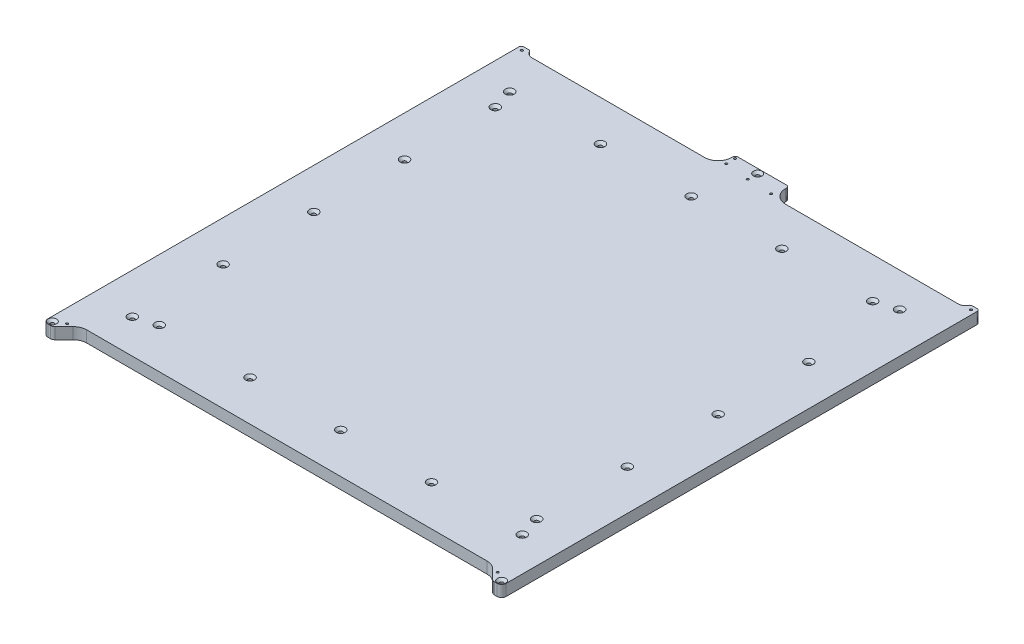
from build123d import *

# Parameters (mm, degrees)
BOSS_EXTRUDE1_DEPTH                             = 12.7
CSK_FOR_M4_FLAT_HEAD_MACHINE_SCREW1_D           = 4.3
CSK_FOR_M4_FLAT_HEAD_MACHINE_SCREW1_CSINK_D     = 9.4
CSK_FOR_M4_FLAT_HEAD_MACHINE_SCREW1_CSINK_ANGLE = 90
CHAMFER1_SIZE                                   = 16
SKETCH6_W                                       = 10
SKETCH6_H                                       = 6
BOSS_EXTRUDE2_DEPTH                             = 12.7
FILLET5_R                                       = 8
M3X0_5_TAPPED_HOLE1_D                           = 2.5
FILLET6_START                                   = -1
FILLET6_DEPTH                                   = 15
SKETCH18_W                                      = 25
SKETCH18_H                                      = 19
BOSS_EXTRUDE4_DEPTH                             = 12.7
FILLET11_R                                      = 15
FILLET12_R                                      = 3
M3X0_5_TAPPED_HOLE2_D                           = 2.5
CSK_FOR_M4_FLAT_HEAD_MACHINE_SCREW2_D           = 4.5
CSK_FOR_M4_FLAT_HEAD_MACHINE_SCREW2_CSINK_D     = 9.9
CSK_FOR_M4_FLAT_HEAD_MACHINE_SCREW2_CSINK_ANGLE = 90


with BuildPart() as part:
    # Sketch1 → Boss-Extrude1 (new body)
    with BuildSketch(Plane(origin=(0, 0, 0), x_dir=(1, 0, 0), z_dir=(0, 1, 0))):
        Polygon((-5, 274), (5, 274), (5, 255), (255, 255), (255, -271), (245, -271), (245, -255), (-245, -255), (-245, -271), (-255, -271), (-255, 255), (-5, 255), align=None)
    extrude(amount=BOSS_EXTRUDE1_DEPTH)

    # CSK for M4 Flat Head Machine Screw1 (through all)
    with Locations(Plane(origin=(0, 12.7, 0), x_dir=(1, 0, 0), z_dir=(0, 1, 0))):
        with Locations((0, 269), (-250, -266), (250, -266)):
            CounterSinkHole(CSK_FOR_M4_FLAT_HEAD_MACHINE_SCREW1_D / 2, CSK_FOR_M4_FLAT_HEAD_MACHINE_SCREW1_CSINK_D / 2, counter_sink_angle=CSK_FOR_M4_FLAT_HEAD_MACHINE_SCREW1_CSINK_ANGLE)

    # Chamfer1
    chamfer1_edges = [part.edges().sort_by_distance(p)[0] for p in [
        (245, 6.35, 255),
        (-245, 6.35, 255),
    ]]
    chamfer(chamfer1_edges, length=CHAMFER1_SIZE - 0.0001)  # a hair under: the kernel refuses the full size

    # Sketch6 → Boss-Extrude2 (add)
    with BuildSketch(Plane(origin=(0, 12.7, 0), x_dir=(1, 0, 0), z_dir=(0, 1, 0))):
        with Locations((-250, 258)):
            Rectangle(SKETCH6_W, SKETCH6_H)
        with Locations((250, 258)):
            Rectangle(SKETCH6_W, SKETCH6_H)
    extrude(amount=-BOSS_EXTRUDE2_DEPTH)

    # Fillet5
    # the kernel refuses this fillet: 8 mm, written as the material it adds along each edge
    with BuildSketch(Plane(origin=(245, 12.7, -255), x_dir=(0, 0, -1), z_dir=(0, -1, 0))) as fillet5_piece_1:
        with BuildLine():
            CenterArc((8, -7.745966692), FILLET5_R, 104.477512186, 75.522487814)
            Line((0, -7.745966692), (-0.16, -7.745966692))
            Line((-0.16, -7.745966692), (-0.16, 0))
            Line((-0.16, 0), (0, 0.16))
            ThreePointArc((0, 0.16), (3, 0.16), (5.96, 0.154919334))
            Line((5.96, 0.154919334), (6, 0))
        make_face()
    extrude(amount=12.7)
    with BuildSketch(Plane(origin=(-245, 12.7, -255), x_dir=(1, 0, 0), z_dir=(0, -1, 0))) as fillet5_piece_2:
        with BuildLine():
            CenterArc((7.745966692, -8), FILLET5_R, 90, 75.522487814)
            Line((0, -6), (-0.154919334, -5.96))
            ThreePointArc((-0.154919334, -5.96), (-0.16, -3), (-0.16, 0))
            Line((-0.16, 0), (0, 0.16))
            Line((0, 0.16), (7.745966692, 0.16))
            Line((7.745966692, 0.16), (7.745966692, 0))
        make_face()
    extrude(amount=12.7)

    # M3x0.5 Tapped Hole1 (through all)
    with Locations(Plane(origin=(0, 12.7, 0), x_dir=(1, 0, 0), z_dir=(0, 1, 0))):
        with Locations((-250, 256.5), (250, 256.5), (239.607695155, -260), (-239.607695155, -260), (0, 258)):
            Hole(M3X0_5_TAPPED_HOLE1_D / 2)

    # Fillet6: read off the stored shape, not the designer's step
    # Fillet6 outline → Fillet6 (cut)
    with BuildSketch(Plane(origin=(0, 0, 0), x_dir=(1, 0, 0), z_dir=(0, 1, 0)).offset(FILLET6_START)):
        with BuildLine():
            ThreePointArc((255, -266), (253.535533906, -269.535533906), (250, -271))
            Line((250, -271), (255, -271))
            Line((255, -271), (255, -266))
        make_face()
        with BuildLine():
            ThreePointArc((247.071067812, -271), (245.15765065, -270.619397663), (243.535533906, -269.535533906))
            Line((243.535533906, -269.535533906), (245, -271))
            Line((245, -271), (247.071067812, -271))
        make_face()
        with BuildLine():
            ThreePointArc((-243.535533906, -269.535533906), (-245.15765065, -270.619397663), (-247.071067812, -271))
            Line((-247.071067812, -271), (-245, -271))
            Line((-245, -271), (-243.535533906, -269.535533906))
        make_face()
        with BuildLine():
            Line((-255, -271), (-250, -271))
            ThreePointArc((-250, -271), (-253.535533906, -269.535533906), (-255, -266))
            Line((-255, -266), (-255, -271))
        make_face()
    extrude(amount=FILLET6_DEPTH, mode=Mode.SUBTRACT)

    # Sketch18 → Boss-Extrude4 (add)
    with BuildSketch(Plane.XZ):
        with Locations((17.5, -264.5)):
            Rectangle(SKETCH18_W, SKETCH18_H)
        with Locations((-17.5, -264.5)):
            Rectangle(SKETCH18_W, SKETCH18_H)
    extrude(amount=-BOSS_EXTRUDE4_DEPTH)

    # Fillet11
    fillet11_edges = [part.edges().sort_by_distance(p)[0] for p in [
        (30, 6.35, -255),
        (-30, 6.35, -255),
        (-229.0001, 6.35, 255),
        (229.0001, 6.35, 255),
    ]]
    fillet(fillet11_edges, radius=FILLET11_R)

    # Fillet12
    fillet12_edges = [part.edges().sort_by_distance(p)[0] for p in [
        (30, 6.35, -274),
        (-30, 6.35, -274),
        (-245, 6.35, -261),
        (-255, 6.35, -261),
        (245, 6.35, -261),
        (255, 6.35, -261),
    ]]
    fillet(fillet12_edges, radius=FILLET12_R)

    # M3x0.5 Tapped Hole2 (through all)
    with Locations(Plane(origin=(0, 12.7, 0), x_dir=(1, 0, 0), z_dir=(0, 1, 0))):
        with Locations((27, 257), (-27, 271), (-27, 261)):
            Hole(M3X0_5_TAPPED_HOLE2_D / 2)

    # CSK for M4 Flat Head Machine Screw2 (through all)
    with Locations(Plane(origin=(0, 12.7, 0), x_dir=(1, 0, 0), z_dir=(0, 1, 0))):
        with Locations((-210, -217), (-187, -210), (-86, -210), (-210, -116), (-210, -15), (-210, 86), (-210, 187), (-217, 210), (-116, 210), (-15, 210), (86, 210), (187, 210), (210, 217), (210, 116), (210, 15), (210, -86), (210, -187), (217, -210), (116, -210), (15, -210)):
            CounterSinkHole(CSK_FOR_M4_FLAT_HEAD_MACHINE_SCREW2_D / 2, CSK_FOR_M4_FLAT_HEAD_MACHINE_SCREW2_CSINK_D / 2, counter_sink_angle=CSK_FOR_M4_FLAT_HEAD_MACHINE_SCREW2_CSINK_ANGLE)


solid = part.part
